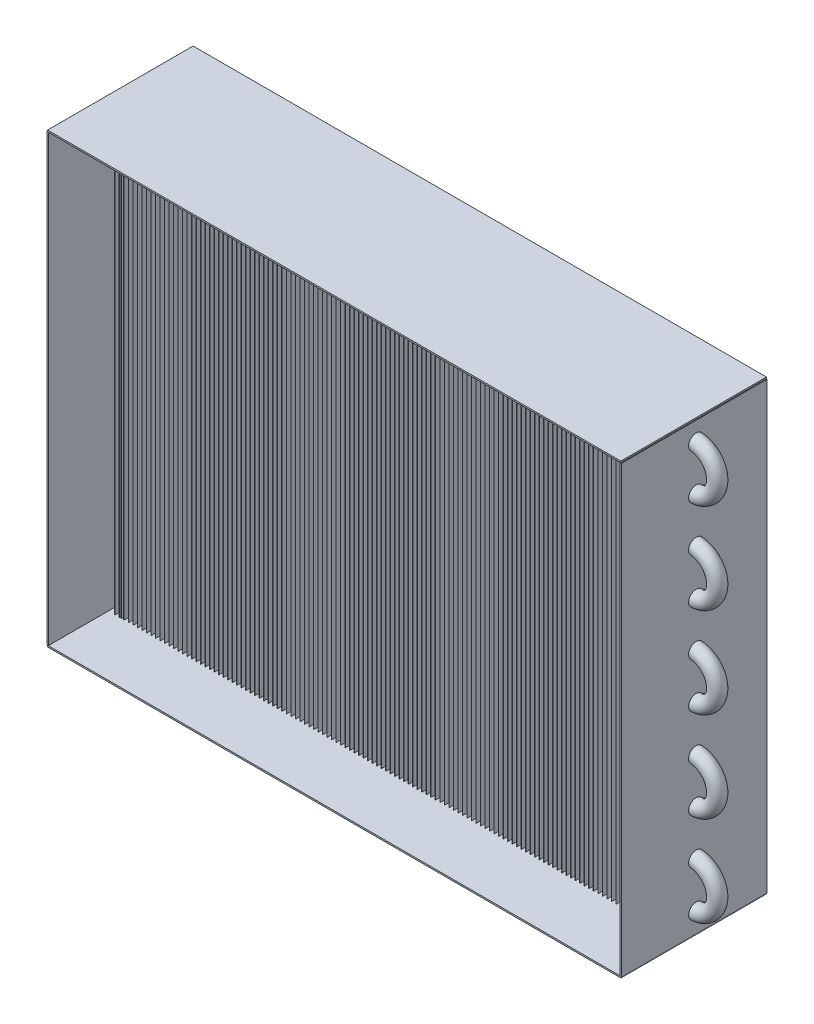
from build123d import *

# Parameters (mm, degrees)
SWEEP1_PROFILE_R    = 5
SKETCH12_W          = 96.741149764
SKETCH12_H          = 295.489600589
BOSS_EXTRUDE1_DEPTH = 1
SKETCH11_W          = 96.741149764
SKETCH11_H          = 295.489600589
BOSS_EXTRUDE2_DEPTH = 1
SKETCH15_R          = 5
CUT_EXTRUDE2_DEPTH  = 1
SKETCH17_W          = 381
SKETCH17_H          = 96.741149764
BOSS_EXTRUDE4_DEPTH = 1
SKETCH18_W          = 381
SKETCH18_H          = 96.741149764
BOSS_EXTRUDE5_DEPTH = 1
SKETCH19_W          = 31.357463718
SKETCH19_H          = 284.218713699
BOSS_EXTRUDE6_DEPTH = 0.2
LPATTERN2_COUNT     = 122
LPATTERN2_PITCH     = 3


with BuildPart() as part:
    # Sweep1: sweep along a path in Sketch2
    with BuildLine(Plane.XY) as sweep1_path:
        Line((0, 16.000063534), (380, 16.000063534))
        ThreePointArc((380, 16.000063534), (395, 1.000063534), (380, -13.999936466))
        Line((380, -13.999936466), (0, -13.999936466))
        ThreePointArc((0, -13.999936466), (-15, -28.999936466), (0, -43.999936466))
        Line((0, -43.999936466), (380, -43.999936466))
        ThreePointArc((380, -43.999936466), (395, -58.999936466), (380, -73.999936466))
        Line((380, -73.999936466), (0, -73.999936466))
        ThreePointArc((0, -73.999936466), (-15, -88.999936466), (0, -103.999936466))
        Line((0, -103.999936466), (380, -103.999936466))
        ThreePointArc((380, -103.999936466), (395, -118.999936466), (380, -133.999936466))
        Line((380, -133.999936466), (0, -133.999936466))
        ThreePointArc((0, -133.999936466), (-15, -148.999936466), (0, -163.999936466))
        Line((0, -163.999936466), (380, -163.999936466))
        ThreePointArc((380, -163.999936466), (395, -178.999936466), (380, -193.999936466))
        Line((380, -193.999936466), (0, -193.999936466))
        ThreePointArc((0, -193.999936466), (-15, -208.999936466), (0, -223.999936466))
        Line((0, -223.999936466), (380, -223.999936466))
        ThreePointArc((380, -223.999936466), (395, -238.999936466), (380, -253.999936466))
        Line((380, -253.999936466), (0, -253.999936466))
    # Sweep1 profile (on start of the path) → Sweep1 (sweep)
    with BuildSketch(Plane(origin=(0, 16.000063534, 0), x_dir=(0, 0, 1), z_dir=(1, 0, 0))):
        Circle(SWEEP1_PROFILE_R)
    sweep(path=sweep1_path.line)

    # Sketch12 → Boss-Extrude1 (add)
    with BuildSketch(Plane(origin=(380, 0, 0), x_dir=(0, 0, -1), z_dir=(1, 0, 0))):
        with Locations((-1.170255844, -119.432585709)):
            Rectangle(SKETCH12_W, SKETCH12_H)
    extrude(amount=BOSS_EXTRUDE1_DEPTH)

    # Sketch11 → Boss-Extrude2 (add)
    with BuildSketch(Plane.ZY):
        with Locations((1.170255844, -119.432585709)):
            Rectangle(SKETCH11_W, SKETCH11_H)
    extrude(amount=BOSS_EXTRUDE2_DEPTH)

    # Sketch15 → Cut-Extrude2 (cut)
    with BuildSketch(Plane.ZY):
        with Locations((0, 15.975050499)):
            Circle(SKETCH15_R)
    extrude(amount=CUT_EXTRUDE2_DEPTH, mode=Mode.SUBTRACT)

    # Sketch17 → Boss-Extrude4 (add)
    with BuildSketch(Plane(origin=(0, 28.312214586, 0), x_dir=(1, 0, 0), z_dir=(0, 1, 0))):
        with Locations((190, -1.170255844)):
            Rectangle(SKETCH17_W, SKETCH17_H)
    extrude(amount=BOSS_EXTRUDE4_DEPTH)

    # Sketch18 → Boss-Extrude5 (add)
    with BuildSketch(Plane(origin=(0, -267.177386003, 0), x_dir=(-1, 0, 0), z_dir=(0, -1, 0))):
        with Locations((-190, -1.170255844)):
            Rectangle(SKETCH18_W, SKETCH18_H)
    extrude(amount=BOSS_EXTRUDE5_DEPTH)

    # Sketch19 → Boss-Extrude6 (add)
    with BuildSketch(Plane(origin=(10, 0, 0), x_dir=(0, 0, -1), z_dir=(1, 0, 0))):
        with Locations((0.275300994, -119.321389029)):
            Rectangle(SKETCH19_W, SKETCH19_H)
    boss_extrude6 = extrude(amount=BOSS_EXTRUDE6_DEPTH)

    # Mirror1: Boss-Extrude6 across plane
    add(boss_extrude6.mirror(Plane(origin=(12.2, 0, 0), x_dir=(0, 0, 1), z_dir=(1, 0, 0))))

    # LPattern2: Boss-Extrude6 ×122
    with Locations(*[(i * LPATTERN2_PITCH, 0, 0) for i in range(1, LPATTERN2_COUNT)]):
        add(boss_extrude6)


solid = part.part
